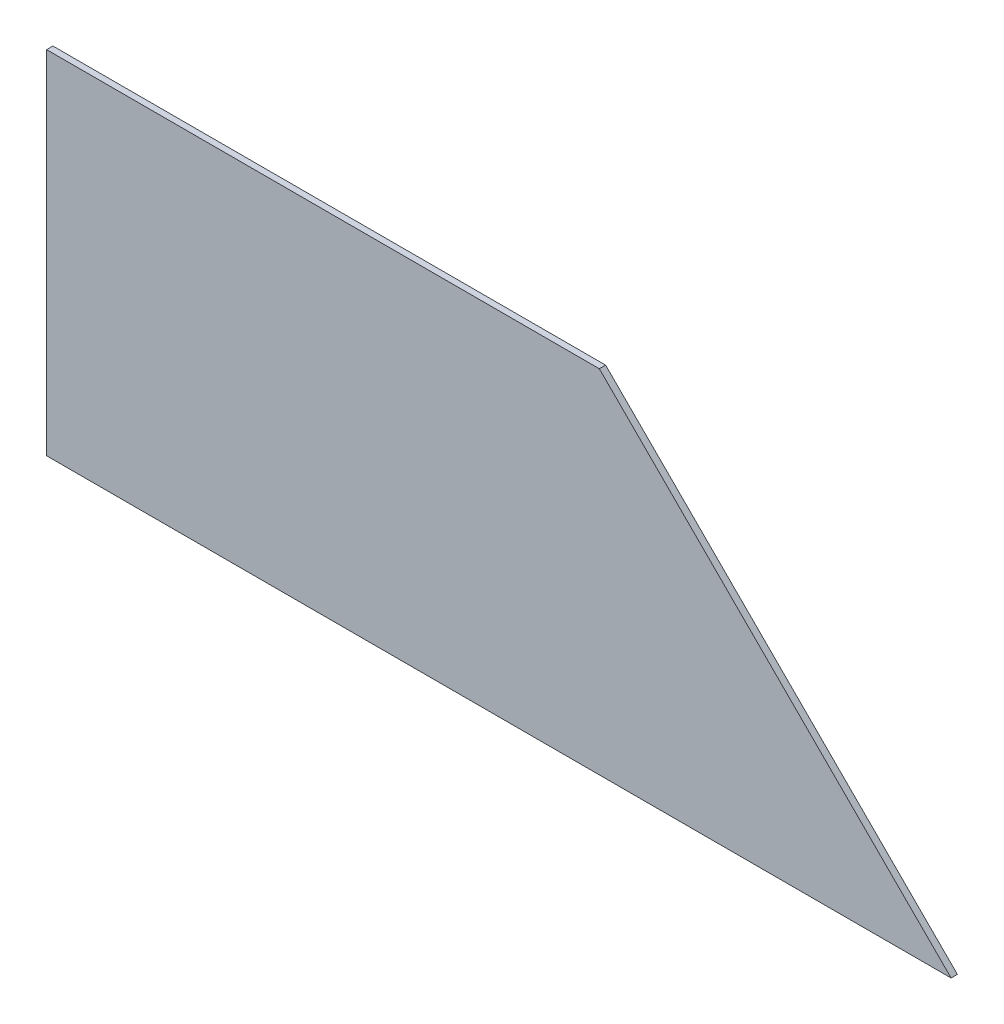
from build123d import *

# Parameters (mm, degrees)
BOSS_EXTRUDE1_DEPTH = 3.175


with BuildPart() as part:
    # Sketch1 → Boss-Extrude1 (new body)
    with BuildSketch(Plane.XY):
        Polygon((279.4, 177.8), (457.2, 0), (127, 0), (0, 0), (0, 177.8), align=None)
    extrude(amount=BOSS_EXTRUDE1_DEPTH)


solid = part.part
